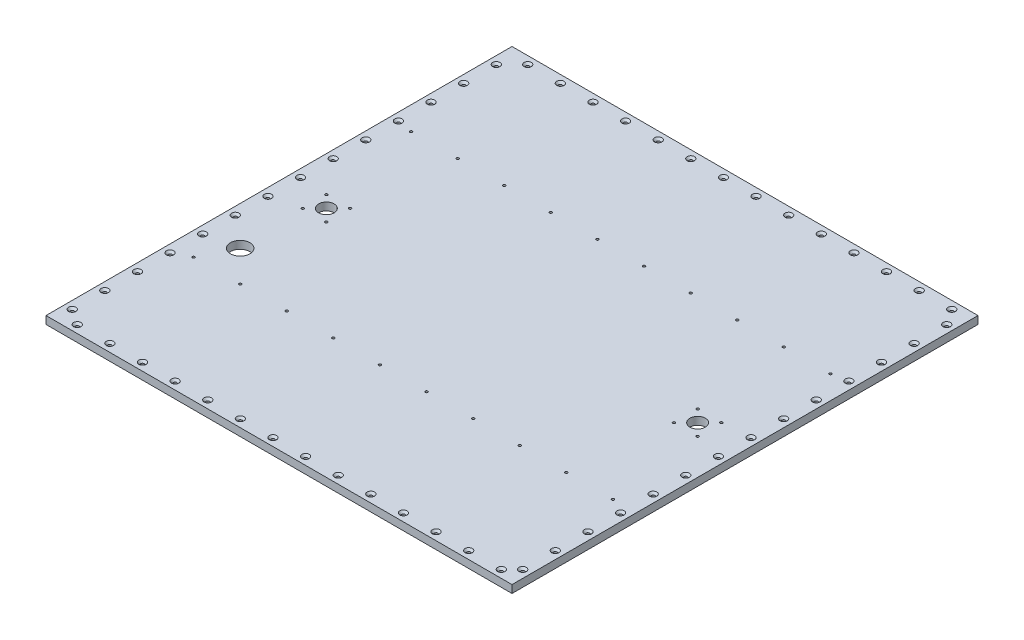
from build123d import *

# Parameters (mm, degrees)
SKETCH1_W                                       = 600
SKETCH1_H                                       = 600
BOSS_EXTRUDE1_DEPTH                             = 10
CSK_FOR_M4_FLAT_HEAD_MACHINE_SCREW1_D           = 4.3
CSK_FOR_M4_FLAT_HEAD_MACHINE_SCREW1_CSINK_D     = 9.4
CSK_FOR_M4_FLAT_HEAD_MACHINE_SCREW1_CSINK_ANGLE = 90
CSK_FOR_M3_FLAT_HEAD_MACHINE_SCREW1_D           = 3.2
CSK_FOR_M3_FLAT_HEAD_MACHINE_SCREW1_CSINK_D     = 6.3
CSK_FOR_M3_FLAT_HEAD_MACHINE_SCREW1_CSINK_ANGLE = 90
SKETCH7_R                                       = 10
CUT_EXTRUDE1_DEPTH                              = 10
CSK_FOR_M3_FLAT_HEAD_MACHINE_SCREW2_D           = 3.2
CSK_FOR_M3_FLAT_HEAD_MACHINE_SCREW2_CSINK_D     = 6.3
CSK_FOR_M3_FLAT_HEAD_MACHINE_SCREW2_CSINK_ANGLE = 90
CSK_FOR_M3_FLAT_HEAD_MACHINE_SCREW3_D           = 3.2
CSK_FOR_M3_FLAT_HEAD_MACHINE_SCREW3_CSINK_D     = 6.3
CSK_FOR_M3_FLAT_HEAD_MACHINE_SCREW3_CSINK_ANGLE = 90
CSK_FOR_M3_FLAT_HEAD_MACHINE_SCREW4_D           = 3.2
CSK_FOR_M3_FLAT_HEAD_MACHINE_SCREW4_DEPTH       = 6
CSK_FOR_M3_FLAT_HEAD_MACHINE_SCREW4_CSINK_D     = 6.3
CSK_FOR_M3_FLAT_HEAD_MACHINE_SCREW4_CSINK_ANGLE = 90
CSK_FOR_M3_FLAT_HEAD_MACHINE_SCREW4_TIP         = 0.96137699
SKETCH14_R                                      = 4
CUT_EXTRUDE2_DEPTH                              = 5
SKETCH15_R                                      = 4
CUT_EXTRUDE3_DEPTH                              = 5
SKETCH16_R                                      = 12.5
CUT_EXTRUDE4_DEPTH                              = 10


with BuildPart() as part:
    # Sketch1 → Boss-Extrude1 (new body)
    with BuildSketch(Plane(origin=(0, 0, 0), x_dir=(1, 0, 0), z_dir=(0, 1, 0))):
        with Locations((300, 300)):
            Rectangle(SKETCH1_W, SKETCH1_H)
    extrude(amount=BOSS_EXTRUDE1_DEPTH)

    # CSK for M4 Flat Head Machine Screw1 (through all)
    with Locations(Plane(origin=(0, 10, 0), x_dir=(1, 0, 0), z_dir=(0, 1, 0))):
        with Locations((10, 569.75), (30.25, 590), (72.25, 590), (114.25, 590), (156.25, 590), (198.25, 590), (240.25, 590), (282.25, 590), (324.25, 590), (366.25, 590), (408.25, 590), (450.25, 590), (492.25, 590), (534.25, 590), (576.25, 590), (72.25, 10), (114.25, 10), (156.25, 10), (198.25, 10), (240.25, 10), (282.25, 10), (324.25, 10), (366.25, 10), (408.25, 10), (450.25, 10), (492.25, 10), (534.25, 10), (576.25, 10), (30.25, 10), (590, 569.75), (590, 527.75), (590, 485.75), (590, 443.75), (590, 401.75), (590, 359.75), (590, 317.75), (590, 275.75), (590, 233.75), (590, 191.75), (590, 149.75), (590, 107.75), (590, 65.75), (590, 23.75), (10, 527.75), (10, 485.75), (10, 443.75), (10, 401.75), (10, 359.75), (10, 317.75), (10, 275.75), (10, 233.75), (10, 191.75), (10, 149.75), (10, 107.75), (10, 65.75), (10, 23.75)):
            CounterSinkHole(CSK_FOR_M4_FLAT_HEAD_MACHINE_SCREW1_D / 2, CSK_FOR_M4_FLAT_HEAD_MACHINE_SCREW1_CSINK_D / 2, counter_sink_angle=CSK_FOR_M4_FLAT_HEAD_MACHINE_SCREW1_CSINK_ANGLE)

    # CSK for M3 Flat Head Machine Screw1 (through all)
    with Locations(Plane(origin=(0, 0, 0), x_dir=(-1, 0, 0), z_dir=(0, -1, 0))):
        with Locations((-570, 160), (-570, 440), (-510, 160), (-510, 440), (-450, 160), (-450, 440), (-390, 160), (-390, 440), (-330, 160), (-330, 440), (-270, 160), (-270, 440), (-210, 160), (-210, 440), (-150, 160), (-150, 440), (-90, 160), (-90, 440), (-30, 160), (-30, 440)):
            CounterSinkHole(CSK_FOR_M3_FLAT_HEAD_MACHINE_SCREW1_D / 2, CSK_FOR_M3_FLAT_HEAD_MACHINE_SCREW1_CSINK_D / 2, counter_sink_angle=CSK_FOR_M3_FLAT_HEAD_MACHINE_SCREW1_CSINK_ANGLE)

    # Sketch7 → Cut-Extrude1 (cut)
    with BuildSketch(Plane(origin=(0, 0, 0), x_dir=(-1, 0, 0), z_dir=(0, -1, 0))):
        with Locations((-61, 300)):
            Circle(SKETCH7_R)
        with Locations((-539, 300)):
            Circle(SKETCH7_R)
    extrude(amount=-CUT_EXTRUDE1_DEPTH, mode=Mode.SUBTRACT)

    # CSK for M3 Flat Head Machine Screw2 (through all)
    with Locations(Plane(origin=(0, 0, 0), x_dir=(-1, 0, 0), z_dir=(0, -1, 0))):
        with Locations((-45.75, 315.25), (-76.25, 315.25), (-76.25, 284.75), (-45.75, 284.75)):
            CounterSinkHole(CSK_FOR_M3_FLAT_HEAD_MACHINE_SCREW2_D / 2, CSK_FOR_M3_FLAT_HEAD_MACHINE_SCREW2_CSINK_D / 2, counter_sink_angle=CSK_FOR_M3_FLAT_HEAD_MACHINE_SCREW2_CSINK_ANGLE)

    # CSK for M3 Flat Head Machine Screw3 (through all)
    with Locations(Plane(origin=(0, 0, 0), x_dir=(-1, 0, 0), z_dir=(0, -1, 0))):
        with Locations((-523.75, 315.25), (-554.25, 315.25), (-554.25, 284.75), (-523.75, 284.75)):
            CounterSinkHole(CSK_FOR_M3_FLAT_HEAD_MACHINE_SCREW3_D / 2, CSK_FOR_M3_FLAT_HEAD_MACHINE_SCREW3_CSINK_D / 2, counter_sink_angle=CSK_FOR_M3_FLAT_HEAD_MACHINE_SCREW3_CSINK_ANGLE)

    # CSK for M3 Flat Head Machine Screw4
    with Locations(Plane(origin=(0, 0, 0), x_dir=(-1, 0, 0), z_dir=(0, -1, 0))):
        with Locations((-549.5, 118.5), (-549.5, 68.8), (-397.5, 118.5), (-397.5, 68.8)):
            CounterSinkHole(CSK_FOR_M3_FLAT_HEAD_MACHINE_SCREW4_D / 2, CSK_FOR_M3_FLAT_HEAD_MACHINE_SCREW4_CSINK_D / 2, depth=CSK_FOR_M3_FLAT_HEAD_MACHINE_SCREW4_DEPTH, counter_sink_angle=CSK_FOR_M3_FLAT_HEAD_MACHINE_SCREW4_CSINK_ANGLE)
            with Locations((0, 0, -(CSK_FOR_M3_FLAT_HEAD_MACHINE_SCREW4_DEPTH + CSK_FOR_M3_FLAT_HEAD_MACHINE_SCREW4_TIP / 2))):  # 118° drill point
                Cone(0, CSK_FOR_M3_FLAT_HEAD_MACHINE_SCREW4_D / 2, CSK_FOR_M3_FLAT_HEAD_MACHINE_SCREW4_TIP, mode=Mode.SUBTRACT)

    # Sketch14 → Cut-Extrude2 (cut)
    with BuildSketch(Plane.XZ):
        with Locations((425, -42)):
            Circle(SKETCH14_R)
    extrude(amount=-CUT_EXTRUDE2_DEPTH, mode=Mode.SUBTRACT)

    # Sketch15 → Cut-Extrude3 (cut)
    with BuildSketch(Plane(origin=(0, 0, 0), x_dir=(-1, 0, 0), z_dir=(0, -1, 0))):
        with Locations((-175, 42)):
            Circle(SKETCH15_R)
    extrude(amount=-CUT_EXTRUDE3_DEPTH, mode=Mode.SUBTRACT)

    # Sketch16 → Cut-Extrude4 (cut)
    with BuildSketch(Plane(origin=(0, 10, 0), x_dir=(1, 0, 0), z_dir=(0, 1, 0))):
        with Locations((50, 200)):
            Circle(SKETCH16_R)
    extrude(amount=-CUT_EXTRUDE4_DEPTH, mode=Mode.SUBTRACT)


solid = part.part
